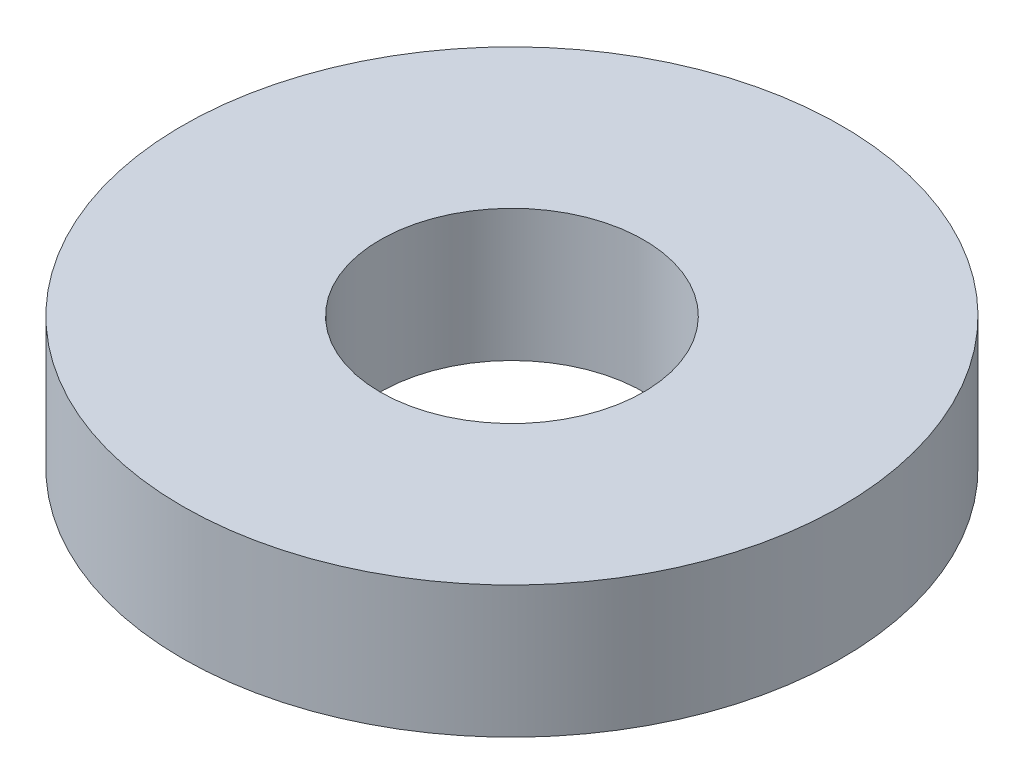
from build123d import *

# Parameters (mm, degrees)
SKETCH1_R           = 50
BOSS_EXTRUDE1_DEPTH = 20
SKETCH2_R           = 20
CUT_EXTRUDE1_DEPTH  = 74.484692283


with BuildPart() as part:
    # Sketch1 → Boss-Extrude1 (new body)
    with BuildSketch(Plane(origin=(0, 0, 0), x_dir=(1, 0, 0), z_dir=(0, 1, 0))):
        Circle(SKETCH1_R)
    extrude(amount=BOSS_EXTRUDE1_DEPTH)

    # Sketch2 → Cut-Extrude1 (cut, through all)
    with BuildSketch(Plane(origin=(0, 0, 0), x_dir=(1, 0, 0), z_dir=(0, 1, 0))):
        Circle(SKETCH2_R)
    extrude(amount=CUT_EXTRUDE1_DEPTH, mode=Mode.SUBTRACT)


solid = part.part
